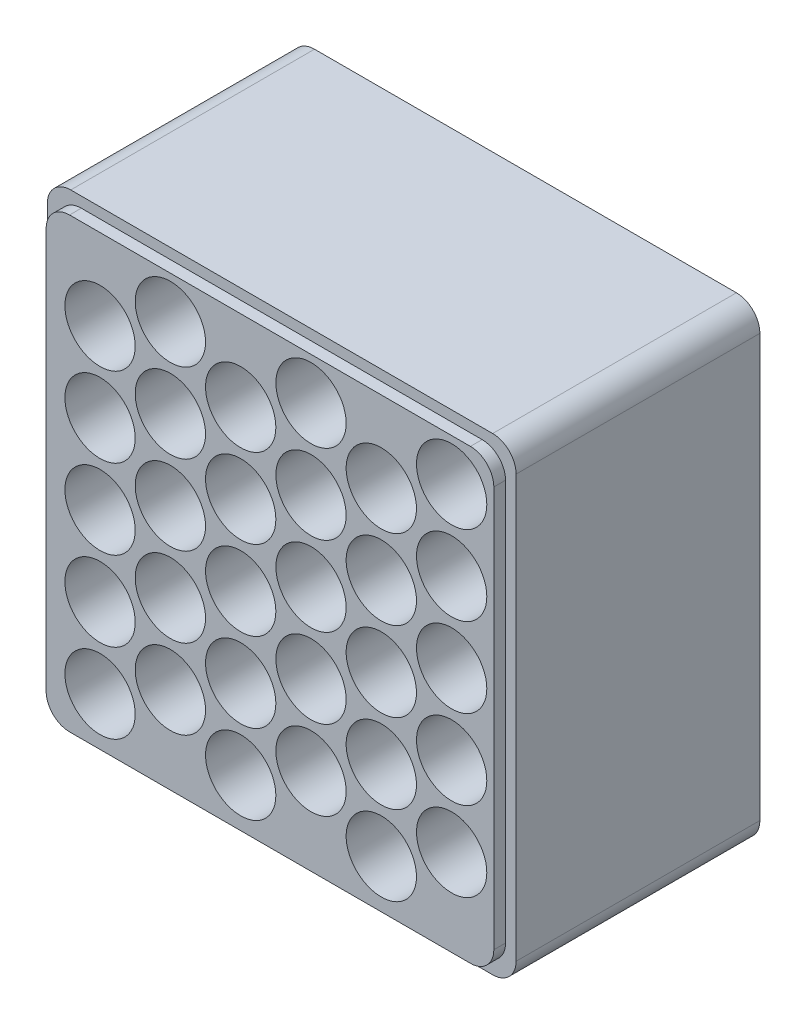
from build123d import *

# Parameters (mm, degrees)
SKETCH1_W                 = 100
SKETCH1_H                 = 100
BOSS_EXTRUDE1_DEPTH       = 52
SKETCH2_W                 = 95.5
SKETCH2_H                 = 95.5
BOSS_EXTRUDE2_DEPTH       = 2.5
SKETCH3_W                 = 96
SKETCH3_H                 = 96
CUT_EXTRUDE1_DEPTH        = 13
SKETCH4_R                 = 7.5
CUT_EXTRUDE2_DEPTH        = 37.5
LPATTERN1_COUNT           = 5
LPATTERN1_PITCH           = 17
LPATTERN1_COUNT_DIR2      = 3
LPATTERN1_PITCH_DIR2      = 30
SKETCH_PATTERN1_START     = 17
SKETCH_PATTERN1_OUTLINE_R = 7.5
SKETCH_PATTERN1_DEPTH     = 37.5
FILLET1_R                 = 5
FILLET2_R                 = 2


# Read off the part's stored shape, not the designer's step: Sketch-Pattern1
with BuildPart() as part:
    # Sketch1 → Boss-Extrude1 (new body)
    with BuildSketch(Plane.XY):
        Rectangle(SKETCH1_W, SKETCH1_H)
    extrude(amount=BOSS_EXTRUDE1_DEPTH)

    # Sketch2 → Boss-Extrude2 (add)
    with BuildSketch(Plane.XY.offset(52)):
        Rectangle(SKETCH2_W, SKETCH2_H)
    extrude(amount=BOSS_EXTRUDE2_DEPTH)

    # Sketch3 → Cut-Extrude1 (cut)
    with BuildSketch(Plane(origin=(0, 0, 0), x_dir=(-1, 0, 0), z_dir=(0, 0, -1))):
        Rectangle(SKETCH3_W, SKETCH3_H)
    extrude(amount=-CUT_EXTRUDE1_DEPTH, mode=Mode.SUBTRACT)

    # Sketch4 → Cut-Extrude2 (cut)
    with BuildSketch(Plane.XY.offset(54.5)):
        with Locations((38.75, 38.75)):
            Circle(SKETCH4_R)
    cut_extrude2 = extrude(amount=-CUT_EXTRUDE2_DEPTH, mode=Mode.SUBTRACT)

    # LPattern1: Cut-Extrude2 5 × 3
    with Locations(*[(-j * LPATTERN1_PITCH_DIR2, -i * LPATTERN1_PITCH, 0) for i in range(LPATTERN1_COUNT) for j in range(LPATTERN1_COUNT_DIR2) if (i, j) != (0, 0)]):
        add(cut_extrude2, mode=Mode.SUBTRACT)

    # Sketch-Pattern1 outline → Sketch-Pattern1 (cut)
    with BuildSketch(Plane.XY.offset(SKETCH_PATTERN1_START)):
        with Locations((23.75, 30.5)):
            Circle(SKETCH_PATTERN1_OUTLINE_R)
        with Locations((-36.25, 13.5)):
            Circle(SKETCH_PATTERN1_OUTLINE_R)
        with Locations((23.75, -3.5)):
            Circle(SKETCH_PATTERN1_OUTLINE_R)
        with Locations((-6.25, -3.5)):
            Circle(SKETCH_PATTERN1_OUTLINE_R)
        with Locations((-36.25, -3.5)):
            Circle(SKETCH_PATTERN1_OUTLINE_R)
        with Locations((-6.25, 13.5)):
            Circle(SKETCH_PATTERN1_OUTLINE_R)
        with Locations((23.75, 13.5)):
            Circle(SKETCH_PATTERN1_OUTLINE_R)
        with Locations((-36.25, 30.5)):
            Circle(SKETCH_PATTERN1_OUTLINE_R)
        with Locations((-6.25, 30.5)):
            Circle(SKETCH_PATTERN1_OUTLINE_R)
        with Locations((-36.25, -37.5)):
            Circle(SKETCH_PATTERN1_OUTLINE_R)
        with Locations((-6.25, -37.5)):
            Circle(SKETCH_PATTERN1_OUTLINE_R)
        with Locations((23.75, -20.5)):
            Circle(SKETCH_PATTERN1_OUTLINE_R)
        with Locations((-6.25, -20.5)):
            Circle(SKETCH_PATTERN1_OUTLINE_R)
        with Locations((-36.25, -20.5)):
            Circle(SKETCH_PATTERN1_OUTLINE_R)
        with Locations((23.75, -37.5)):
            Circle(SKETCH_PATTERN1_OUTLINE_R)
    extrude(amount=SKETCH_PATTERN1_DEPTH, mode=Mode.SUBTRACT)

    # Fillet1
    fillet1_edges = [part.edges().sort_by_distance(p)[0] for p in [
        (47.75, 47.75, 53.25),
        (-47.75, 47.75, 53.25),
        (-47.75, -47.75, 53.25),
        (47.75, -47.75, 53.25),
        (-48, -48, 6.5),
        (48, -48, 6.5),
        (48, 48, 6.5),
        (-48, 48, 6.5),
        (-50, 50, 26),
        (50, 50, 26),
        (50, -50, 26),
        (-50, -50, 26),
    ]]
    fillet(fillet1_edges, radius=FILLET1_R)

    # Fillet2
    fillet2_edges = [part.edges().sort_by_distance(p)[0] for p in [
        (0, -48, 13),
        (48, 0, 13),
        (-48, 0, 13),
        (0, 48, 13),
        (-46.535533906, 46.535533906, 13),
        (-46.535533906, -46.535533906, 13),
        (46.535533906, 46.535533906, 13),
        (46.535533906, -46.535533906, 13),
    ]]
    fillet(fillet2_edges, radius=FILLET2_R)


solid = part.part
